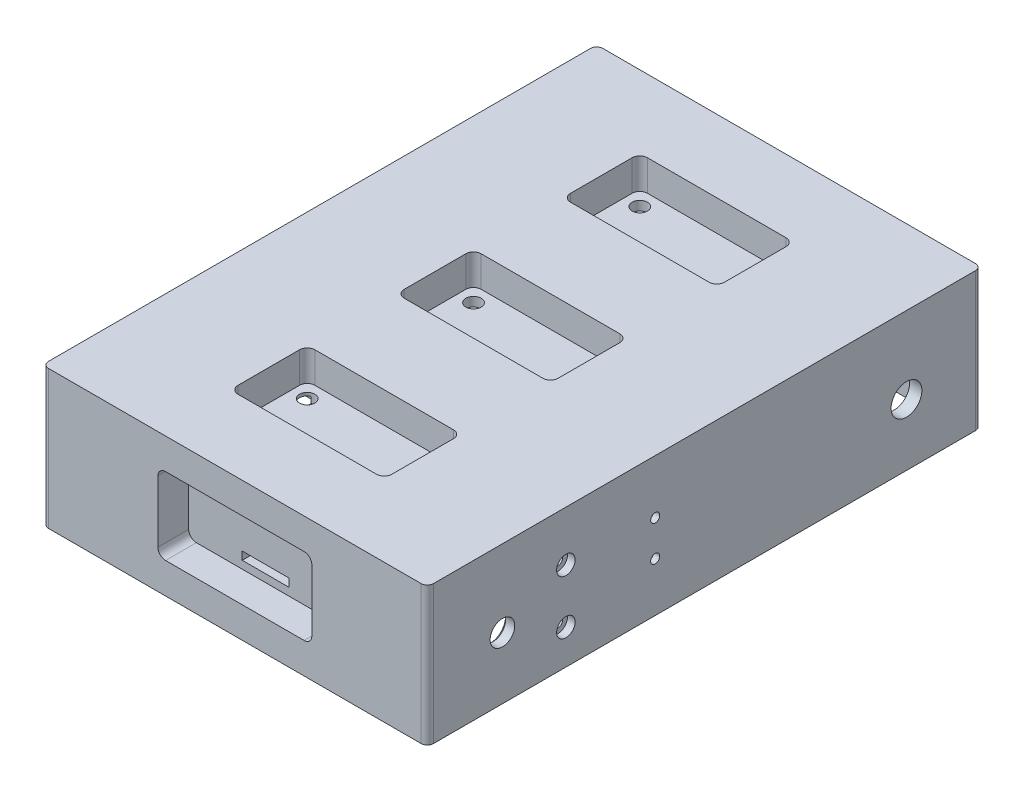
from build123d import *

# Parameters (mm, degrees)
SKETCH_1_W                = 125
SKETCH_1_H                = 180
EXTRUDE_1_DEPTH           = 45
CUT_EXTRUDE_1_DEPTH       = 10
CUT_EXTRUDE_2_DEPTH       = 10
SHELL_1_T                 = -4
SKETCH_5_R                = 1.45
SKETCH_5_R_2              = 4
SKETCH_5_R_3              = 5
CUT_EXTRUDE_3_DEPTH       = 15
SKETCH_6_R                = 3
CUT_EXTRUDE_4_DEPTH       = 2.5
CUT_EXTRUDE_START         = -3
SKETCH_10_W               = 5
SKETCH_10_H               = 36.5
CUT_EXTRUDE_15_DEPTH      = 117.873833693
SKETCH_11_R               = 5
CUT_EXTRUDE_16_DEPTH      = 1
SKETCH_12_R               = 1.45
CUT_EXTRUDE_17_DEPTH      = 14
SKETCH_15_R               = 2.5
SKETCH_15_W               = 15.2
SKETCH_15_H               = 2.6
CUT_EXTRUDE_20_DEPTH      = 3
SKETCH_16_W               = 14
SKETCH_16_H               = 1.8
CUT_EXTRUDE_21_DEPTH      = 3
SKETCH_17_R               = 2.5
SKETCH_17_W               = 15.2
SKETCH_17_H               = 2.6
CUT_EXTRUDE_22_DEPTH      = 3
SKETCH_18_W               = 14
SKETCH_18_H               = 1.8
CUT_EXTRUDE_23_DEPTH      = 3
SKETCH_19_R               = 2.5
SKETCH_19_W               = 15.2
SKETCH_19_H               = 2.6
CUT_EXTRUDE_24_DEPTH      = 3
SKETCH_20_W               = 14
SKETCH_20_H               = 1.8
CUT_EXTRUDE_25_DEPTH      = 5
SKETCH_21_W               = 9.5
SKETCH_21_H               = 14.5
CUT_EXTRUDE_26_DEPTH      = 4
SKETCH_22_R               = 1.425
CUT_EXTRUDE_27_DEPTH      = 9
SKETCH_24_R               = 1.475
CUT_EXTRUDE_28_DEPTH      = 161.468065359
FILLET_1_R                = 2
CUT_EXTRUDE_29_DEPTH      = 119
CUT_EXTRUDE_29_DEPTH_BACK = 2


with BuildPart() as part:
    # Эскиз1 → Бобышка-Вытянуть1 (new body)
    with BuildSketch(Plane(origin=(0, 0, 0), x_dir=(1, 0, 0), z_dir=(0, 1, 0))):
        Rectangle(SKETCH_1_W, SKETCH_1_H)
    extrude(amount=EXTRUDE_1_DEPTH)

    # Эскиз2 → Вырез-Вытянуть1 (cut)
    with BuildSketch(Plane.XY.offset(90)):
        with BuildLine():
            Line((-22.5, 10), (22.5, 10))
            ThreePointArc((22.5, 10), (24.267766953, 10.732233047), (25, 12.5))
            Line((25, 12.5), (25, 32.5))
            ThreePointArc((25, 32.5), (24.267766953, 34.267766953), (22.5, 35))
            Line((22.5, 35), (-22.5, 35))
            ThreePointArc((-22.5, 35), (-24.267766953, 34.267766953), (-25, 32.5))
            Line((-25, 32.5), (-25, 12.5))
            ThreePointArc((-25, 12.5), (-24.267766953, 10.732233047), (-22.5, 10))
        make_face()
    cut_extrude_1 = extrude(amount=-CUT_EXTRUDE_1_DEPTH, mode=Mode.SUBTRACT)

    # Эскиз4 → Вырез-Вытянуть2 (cut)
    with BuildSketch(Plane(origin=(0, 45, 0), x_dir=(1, 0, 0), z_dir=(0, 1, 0))):
        with BuildLine():
            Line((-22.5, 41.5), (22.5, 41.5))
            ThreePointArc((22.5, 41.5), (24.267766953, 42.232233047), (25, 44))
            Line((25, 44), (25, 64))
            ThreePointArc((25, 64), (24.267766953, 65.767766953), (22.5, 66.5))
            Line((22.5, 66.5), (-22.5, 66.5))
            ThreePointArc((-22.5, 66.5), (-24.267766953, 65.767766953), (-25, 64))
            Line((-25, 64), (-25, 44))
            ThreePointArc((-25, 44), (-24.267766953, 42.232233047), (-22.5, 41.5))
        make_face()
        with BuildLine():
            Line((-22.5, -12.5), (22.5, -12.5))
            ThreePointArc((22.5, -12.5), (24.267766953, -11.767766953), (25, -10))
            Line((25, -10), (25, 10))
            ThreePointArc((25, 10), (24.267766953, 11.767766953), (22.5, 12.5))
            Line((22.5, 12.5), (-22.5, 12.5))
            ThreePointArc((-22.5, 12.5), (-24.267766953, 11.767766953), (-25, 10))
            Line((-25, 10), (-25, -10))
            ThreePointArc((-25, -10), (-24.267766953, -11.767766953), (-22.5, -12.5))
        make_face()
        with BuildLine():
            Line((-22.5, -66.5), (22.5, -66.5))
            ThreePointArc((22.5, -66.5), (24.267766953, -65.767766953), (25, -64))
            Line((25, -64), (25, -44))
            ThreePointArc((25, -44), (24.267766953, -42.232233047), (22.5, -41.5))
            Line((22.5, -41.5), (-22.5, -41.5))
            ThreePointArc((-22.5, -41.5), (-24.267766953, -42.232233047), (-25, -44))
            Line((-25, -44), (-25, -64))
            ThreePointArc((-25, -64), (-24.267766953, -65.767766953), (-22.5, -66.5))
        make_face()
    extrude(amount=-CUT_EXTRUDE_2_DEPTH, mode=Mode.SUBTRACT)

    # Зеркальное отражение1: Вырез-Вытянуть1 across plane
    add(cut_extrude_1.mirror(Plane.XY), mode=Mode.SUBTRACT)

    # Оболочка1
    shell_1_openings = [part.faces().sort_by_distance(p)[0] for p in [
        (0, 0, 0),
    ]]
    offset(amount=SHELL_1_T, openings=shell_1_openings, kind=Kind.INTERSECTION)

    # Эскиз5 → Вырез-Вытянуть3 (cut)
    with BuildSketch(Plane.ZY.offset(62.5)):
        with Locations((45, 28.75)):
            Circle(SKETCH_5_R)
        with Locations((45, 11.25)):
            Circle(SKETCH_5_R)
        with Locations((65.6, 20)):
            Circle(SKETCH_5_R_2)
        with Locations((-65.6, 20)):
            Circle(SKETCH_5_R_3)
    cut_extrude_3 = extrude(amount=-CUT_EXTRUDE_3_DEPTH, mode=Mode.SUBTRACT)

    # Эскиз6 → Вырез-Вытянуть4 (cut)
    with BuildSketch(Plane.ZY.offset(62.5)):
        with Locations((45, 28.75)):
            Circle(SKETCH_6_R)
        with Locations((45, 11.25)):
            Circle(SKETCH_6_R)
    cut_extrude_4 = extrude(amount=-CUT_EXTRUDE_4_DEPTH, mode=Mode.SUBTRACT)

    # Эскиз10 → Вырез-Вытянуть15 (cut)
    with BuildSketch(Plane(origin=(0, 31, 0), x_dir=(-1, 0, 0), z_dir=(0, -1, 0)).offset(CUT_EXTRUDE_START)):
        with Locations((23.5, -60.25)):
            Rectangle(SKETCH_10_W, SKETCH_10_H)
    cut_extrude_15 = extrude(amount=CUT_EXTRUDE_15_DEPTH, mode=Mode.SUBTRACT)

    # Эскиз11 → Вырез-Вытянуть16 (cut)
    with BuildSketch(Plane(origin=(-58.5, 0, 0), x_dir=(0, 0, -1), z_dir=(1, 0, 0))):
        with Locations((-65.6, 20)):
            Circle(SKETCH_11_R)
    cut_extrude_16 = extrude(amount=-CUT_EXTRUDE_16_DEPTH, mode=Mode.SUBTRACT)

    # Зеркальное отражение2: Вырез-Вытянуть3, Вырез-Вытянуть4, Вырез-Вытянуть15, Вырез-Вытянуть16 across plane
    add(cut_extrude_3.mirror(Plane(origin=(0, 0, 0), x_dir=(0, 0, 1), z_dir=(1, 0, 0))), mode=Mode.SUBTRACT)
    add(cut_extrude_4.mirror(Plane(origin=(0, 0, 0), x_dir=(0, 0, 1), z_dir=(1, 0, 0))), mode=Mode.SUBTRACT)
    add(cut_extrude_15.mirror(Plane(origin=(0, 0, 0), x_dir=(0, 0, 1), z_dir=(1, 0, 0))), mode=Mode.SUBTRACT)
    add(cut_extrude_16.mirror(Plane(origin=(0, 0, 0), x_dir=(0, 0, 1), z_dir=(1, 0, 0))), mode=Mode.SUBTRACT)

    # Эскиз12 → Вырез-Вытянуть17 (cut)
    with BuildSketch(Plane(origin=(0, 6, 0), x_dir=(-1, 0, 0), z_dir=(0, -1, 0))):
        with Locations((-10, -78)):
            Circle(SKETCH_12_R)
        with Locations((10, -78)):
            Circle(SKETCH_12_R)
    extrude(amount=-CUT_EXTRUDE_17_DEPTH, mode=Mode.SUBTRACT)

    # Эскиз15 → Вырез-Вытянуть20 (cut)
    with BuildSketch(Plane(origin=(0, 35, 0), x_dir=(1, 0, 0), z_dir=(0, 1, 0))):
        with Locations((-20, -46.5)):
            Circle(SKETCH_15_R)
        with Locations((20, -46.5)):
            Circle(SKETCH_15_R)
        with Locations((-20, 7.5)):
            Circle(SKETCH_15_R)
        with Locations((20, 7.5)):
            Circle(SKETCH_15_R)
        with Locations((-20, 61.5)):
            Circle(SKETCH_15_R)
        with Locations((20, 61.5)):
            Circle(SKETCH_15_R)
        with Locations((0, -62.5)):
            Rectangle(SKETCH_15_W, SKETCH_15_H)
        with Locations((0, -8.5)):
            Rectangle(SKETCH_15_W, SKETCH_15_H)
        with Locations((0, 45.5)):
            Rectangle(SKETCH_15_W, SKETCH_15_H)
        with Locations((0, -58.5)):
            Rectangle(SKETCH_15_W, SKETCH_15_H)
        with Locations((0, -4.5)):
            Rectangle(SKETCH_15_W, SKETCH_15_H)
        with Locations((0, 49.5)):
            Rectangle(SKETCH_15_W, SKETCH_15_H)
    extrude(amount=-CUT_EXTRUDE_20_DEPTH, mode=Mode.SUBTRACT)

    # Эскиз16 → Вырез-Вытянуть21 (cut)
    with BuildSketch(Plane(origin=(0, 32, 0), x_dir=(1, 0, 0), z_dir=(0, 1, 0))):
        with Locations((0, -62.5)):
            Rectangle(SKETCH_16_W, SKETCH_16_H)
        with Locations((0, -8.5)):
            Rectangle(SKETCH_16_W, SKETCH_16_H)
        with Locations((0, 45.5)):
            Rectangle(SKETCH_16_W, SKETCH_16_H)
        with Locations((0, -58.5)):
            Rectangle(SKETCH_16_W, SKETCH_16_H)
        with Locations((0, -4.5)):
            Rectangle(SKETCH_16_W, SKETCH_16_H)
        with Locations((0, 49.5)):
            Rectangle(SKETCH_16_W, SKETCH_16_H)
    extrude(amount=-CUT_EXTRUDE_21_DEPTH, mode=Mode.SUBTRACT)

    # Эскиз17 → Вырез-Вытянуть22 (cut)
    with BuildSketch(Plane.XY.offset(80)):
        with Locations((-20, 30)):
            Circle(SKETCH_17_R)
        with Locations((20, 30)):
            Circle(SKETCH_17_R)
        with Locations((0, 13.8)):
            Rectangle(SKETCH_17_W, SKETCH_17_H)
    extrude(amount=-CUT_EXTRUDE_22_DEPTH, mode=Mode.SUBTRACT)

    # Эскиз18 → Вырез-Вытянуть23 (cut)
    with BuildSketch(Plane.XY.offset(77)):
        with Locations((0, 13.8)):
            Rectangle(SKETCH_18_W, SKETCH_18_H)
    extrude(amount=-CUT_EXTRUDE_23_DEPTH, mode=Mode.SUBTRACT)

    # Эскиз19 → Вырез-Вытянуть24 (cut)
    with BuildSketch(Plane(origin=(0, 0, -80), x_dir=(1, 0, 0), z_dir=(0, 0, -1))):
        with Locations((-20, -15)):
            Circle(SKETCH_19_R)
        with Locations((20, -15)):
            Circle(SKETCH_19_R)
        with Locations((0, -31.2)):
            Rectangle(SKETCH_19_W, SKETCH_19_H)
    extrude(amount=-CUT_EXTRUDE_24_DEPTH, mode=Mode.SUBTRACT)

    # Эскиз20 → Вырез-Вытянуть25 (cut)
    with BuildSketch(Plane(origin=(0, 0, -77), x_dir=(1, 0, 0), z_dir=(0, 0, -1))):
        with Locations((0, -31.2)):
            Rectangle(SKETCH_20_W, SKETCH_20_H)
    extrude(amount=-CUT_EXTRUDE_25_DEPTH, mode=Mode.SUBTRACT)

    # Эскиз21 → Вырез-Вытянуть26 (cut)
    with BuildSketch(Plane(origin=(0, 0, -90), x_dir=(1, 0, 0), z_dir=(0, 0, -1))):
        with Locations((52.5, -22.5)):
            Rectangle(SKETCH_21_W, SKETCH_21_H)
    extrude(amount=-CUT_EXTRUDE_26_DEPTH, mode=Mode.SUBTRACT)

    # Эскиз22 → Вырез-Вытянуть27 (cut)
    with BuildSketch(Plane(origin=(0, 0, 0), x_dir=(-1, 0, 0), z_dir=(0, -1, 0))):
        with Locations((-60.5, -88)):
            Circle(SKETCH_22_R)
        with Locations((-60.5, 88)):
            Circle(SKETCH_22_R)
        with Locations((60.5, 88)):
            Circle(SKETCH_22_R)
        with Locations((60.5, -88)):
            Circle(SKETCH_22_R)
        with Locations((0, 88)):
            Circle(SKETCH_22_R)
        with Locations((0, -88)):
            Circle(SKETCH_22_R)
        with Locations((-60.5, 0)):
            Circle(SKETCH_22_R)
        with Locations((60.5, 0)):
            Circle(SKETCH_22_R)
    extrude(amount=-CUT_EXTRUDE_27_DEPTH, mode=Mode.SUBTRACT)

    # Эскиз24 → Вырез-Вытянуть28 (cut, through all)
    with BuildSketch(Plane.ZY.offset(62.5)):
        with Locations((16, 16)):
            Circle(SKETCH_24_R)
        with Locations((16, 27.5)):
            Circle(SKETCH_24_R)
    extrude(amount=-CUT_EXTRUDE_28_DEPTH, mode=Mode.SUBTRACT)

    # Скругление1
    fillet_1_edges = [part.edges().sort_by_distance(p)[0] for p in [
        (62.5, 22.5, -90),
        (-62.5, 22.5, -90),
        (62.5, 22.5, 90),
        (-62.5, 22.5, 90),
    ]]
    fillet(fillet_1_edges, radius=FILLET_1_R)

    # Эскиз26 → Вырез-Вытянуть29 (cut, two sides: drawn at the far end of the back side and taken through both)
    with BuildSketch(Plane.ZY.offset(-58.5).offset(-CUT_EXTRUDE_29_DEPTH_BACK)):
        Polygon((17.645448267, 18.85), (14.354551733, 18.85), (12.709103466, 16), (14.354551733, 13.15), (17.645448267, 13.15), (19.290896534, 16), align=None)
        Polygon((17.645448267, 30.35), (14.354551733, 30.35), (12.709103466, 27.5), (14.354551733, 24.65), (17.645448267, 24.65), (19.290896534, 27.5), align=None)
    extrude(amount=CUT_EXTRUDE_29_DEPTH + CUT_EXTRUDE_29_DEPTH_BACK, mode=Mode.SUBTRACT)


solid = part.part
